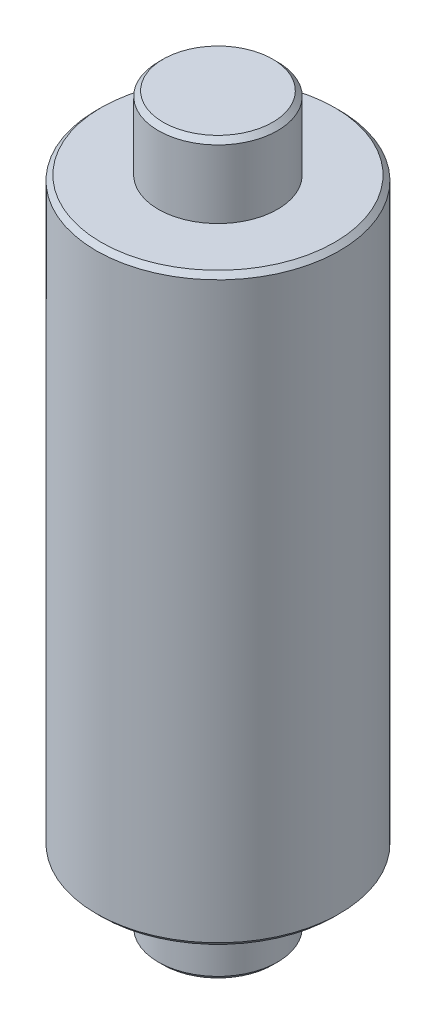
from build123d import *

# Parameters (mm, degrees)
SKETCH1_R           = 2.45
BOSS_EXTRUDE1_DEPTH = 30
CHAMFER1_SIZE       = 0.2
SKETCH2_R           = 5
BOSS_EXTRUDE2_DEPTH = 12
CHAMFER2_SIZE       = 0.2


with BuildPart() as part:
    # Sketch1 → Boss-Extrude1 (new body)
    with BuildSketch(Plane(origin=(0, 0, 0), x_dir=(1, 0, 0), z_dir=(0, 1, 0))):
        Circle(SKETCH1_R)
    extrude(amount=BOSS_EXTRUDE1_DEPTH)

    # Chamfer1
    chamfer1_edges = [part.edges().sort_by_distance(p)[0] for p in [
        (-2.45, 30, 0),
        (-2.45, 0, 0),
    ]]
    chamfer(chamfer1_edges, length=CHAMFER1_SIZE)

    # Sketch2 → Boss-Extrude2 (add, symmetric)
    with BuildSketch(Plane(origin=(0, 15, 0), x_dir=(1, 0, 0), z_dir=(0, 1, 0))):
        Circle(SKETCH2_R)
    extrude(amount=BOSS_EXTRUDE2_DEPTH, both=True)

    # Chamfer2
    chamfer2_edges = [part.edges().sort_by_distance(p)[0] for p in [
        (-5, 3, 0),
        (-5, 27, 0),
    ]]
    chamfer(chamfer2_edges, length=CHAMFER2_SIZE)


solid = part.part
